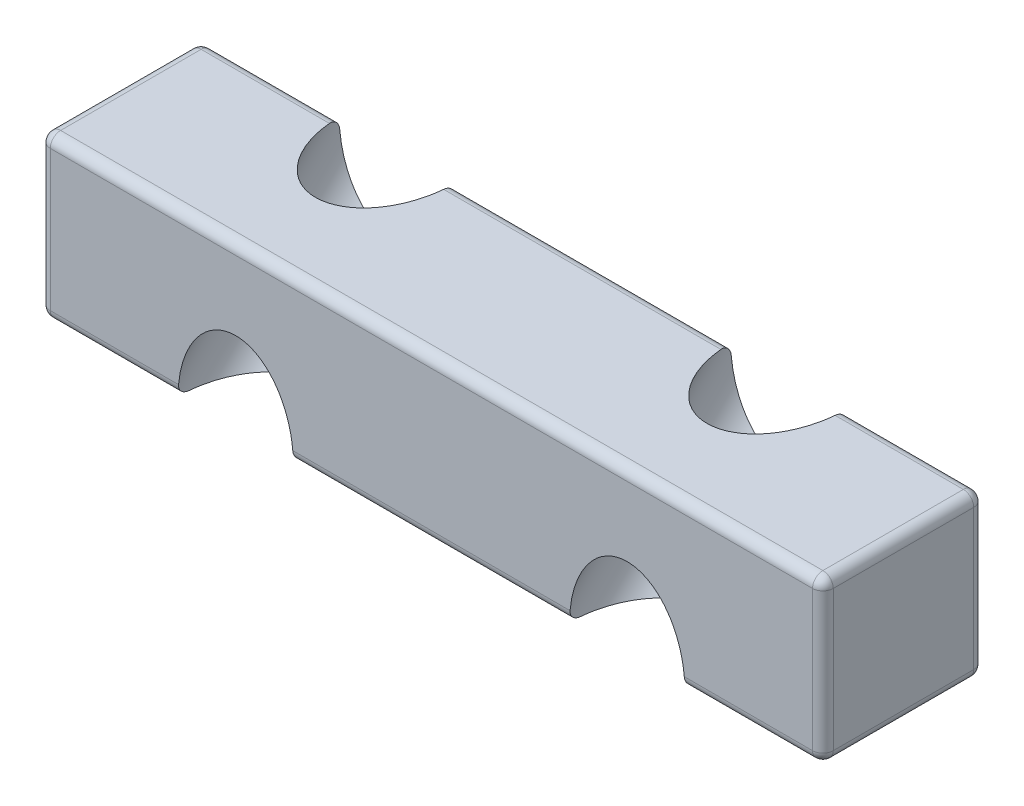
from build123d import *

# Parameters (mm, degrees)
SKETCH1_W               = 34
SKETCH1_H               = 7
BOSS_EXTRUDE1_DEPTH     = 7
CUT_EXTRUDE2_DEPTH      = 36.411862419
CUT_EXTRUDE2_DEPTH_BACK = 36.411862419
SKETCH6_OUTSIDE_W       = 43.082
SKETCH6_OUTSIDE_H       = 18.981
SKETCH6_OUTSIDE_W_2     = 34
SKETCH6_OUTSIDE_H_2     = 9.899494937
SKETCH6_OUTSIDE_R       = 2.5
FILLET1_R               = 0.45


with BuildPart() as part:
    # sketch1 → Boss-Extrude1 (new body)
    with BuildSketch(Plane(origin=(0, 0, 0), x_dir=(1, 0, 0), z_dir=(0, 1, 0))):
        with Locations((17, -3.5)):
            Rectangle(SKETCH1_W, SKETCH1_H)
    extrude(amount=BOSS_EXTRUDE1_DEPTH)

    # Sketch6 outside → Cut-Extrude2 (cut, two sides: drawn at the far end of the back side and taken through both)
    # profile 1 of 3: a face of its own
    with BuildSketch(Plane(origin=(0, 0, 0), x_dir=(-1, 0, 0), z_dir=(0, 0.7071067811865475, -0.7071067811865477)).offset(-CUT_EXTRUDE2_DEPTH_BACK)):
        with Locations((-17, 4.9495)):
            Rectangle(SKETCH6_OUTSIDE_W, SKETCH6_OUTSIDE_H)
        with Locations((-17, 4.949747469)):
            Rectangle(SKETCH6_OUTSIDE_W_2, SKETCH6_OUTSIDE_H_2, mode=Mode.SUBTRACT)
    # profile 2 of 3: a face of its own
    with BuildSketch(Plane(origin=(0, 0, 0), x_dir=(-1, 0, 0), z_dir=(0, 0.7071067811865475, -0.7071067811865477)).offset(-CUT_EXTRUDE2_DEPTH_BACK)):
        with Locations((-25.5, 4.949747468)):
            Circle(SKETCH6_OUTSIDE_R)
    # profile 3 of 3: a face of its own
    with BuildSketch(Plane(origin=(0, 0, 0), x_dir=(-1, 0, 0), z_dir=(0, 0.7071067811865475, -0.7071067811865477)).offset(-CUT_EXTRUDE2_DEPTH_BACK)):
        with Locations(Location((-8.5, 4.949747468, 0), (0, 0, 180))):
            Circle(SKETCH6_OUTSIDE_R)
    extrude(amount=CUT_EXTRUDE2_DEPTH + CUT_EXTRUDE2_DEPTH_BACK, mode=Mode.SUBTRACT)

    # Fillet1
    # the kernel refuses this fillet: 0.45 mm, written as the material it takes off along each edge
    with BuildSketch(Plane(origin=(33.55, 6.55, 0.45), x_dir=(1, 0, 0), z_dir=(0, 0, -1))) as fillet1_piece_1_section:
        Polygon((0, 0), (FILLET1_R, 0), (FILLET1_R, -FILLET1_R), (0, -FILLET1_R), align=None)
    fillet1_piece_1 = extrude(amount=FILLET1_R, mode=Mode.PRIVATE)
    fillet1_piece_1 = fillet1_piece_1 - Plane(origin=(33.55, 6.55, 0.45), x_dir=(-0.7071067811865475, -0.7071067811865475, 0), z_dir=(0, 0, -1)) * Sphere(FILLET1_R, mode=Mode.PRIVATE)
    add(fillet1_piece_1, mode=Mode.SUBTRACT)
    with BuildSketch(Plane(origin=(0.45, 6.55, 0.45), x_dir=(0, 1, 0), z_dir=(0, 0, -1))) as fillet1_piece_2_section:
        Polygon((0, 0), (FILLET1_R, 0), (FILLET1_R, -FILLET1_R), (0, -FILLET1_R), align=None)
    fillet1_piece_2 = extrude(amount=FILLET1_R, mode=Mode.PRIVATE)
    fillet1_piece_2 = fillet1_piece_2 - Plane(origin=(0.45, 6.55, 0.45), x_dir=(0.7071067811865475, -0.7071067811865475, 0), z_dir=(0, 0, -1)) * Sphere(FILLET1_R, mode=Mode.PRIVATE)
    add(fillet1_piece_2, mode=Mode.SUBTRACT)
    with BuildSketch(Plane(origin=(33.55, 0.45, 0.45), x_dir=(0, -1, 0), z_dir=(0, 0, -1))) as fillet1_piece_3_section:
        Polygon((0, 0), (FILLET1_R, 0), (FILLET1_R, -FILLET1_R), (0, -FILLET1_R), align=None)
    fillet1_piece_3 = extrude(amount=FILLET1_R, mode=Mode.PRIVATE)
    fillet1_piece_3 = fillet1_piece_3 - Plane(origin=(33.55, 0.45, 0.45), x_dir=(-0.7071067811865475, 0.7071067811865475, 0), z_dir=(0, 0, -1)) * Sphere(FILLET1_R, mode=Mode.PRIVATE)
    add(fillet1_piece_3, mode=Mode.SUBTRACT)
    with BuildSketch(Plane(origin=(33.55, 0.45, 6.55), x_dir=(1, 0, 0), z_dir=(0, -1, 0))) as fillet1_piece_4_section:
        Polygon((0, 0), (FILLET1_R, 0), (FILLET1_R, FILLET1_R), (0, FILLET1_R), align=None)
    fillet1_piece_4 = extrude(amount=FILLET1_R, mode=Mode.PRIVATE)
    fillet1_piece_4 = fillet1_piece_4 - Plane(origin=(33.55, 0.45, 6.55), x_dir=(-0.7071067811865475, 0, -0.7071067811865475), z_dir=(0, -1, 0)) * Sphere(FILLET1_R, mode=Mode.PRIVATE)
    add(fillet1_piece_4, mode=Mode.SUBTRACT)
    with BuildSketch(Plane(origin=(33.55, 6.55, 6.55), x_dir=(0, 1, 0), z_dir=(1, 0, 0))) as fillet1_piece_5_section:
        Polygon((0, 0), (FILLET1_R, 0), (FILLET1_R, FILLET1_R), (0, FILLET1_R), align=None)
    fillet1_piece_5 = extrude(amount=FILLET1_R, mode=Mode.PRIVATE)
    fillet1_piece_5 = fillet1_piece_5 - Plane(origin=(33.55, 6.55, 6.55), x_dir=(0, -0.7071067811865475, -0.7071067811865475), z_dir=(1, 0, 0)) * Sphere(FILLET1_R, mode=Mode.PRIVATE)
    add(fillet1_piece_5, mode=Mode.SUBTRACT)
    with BuildSketch(Plane(origin=(0.45, 0.45, 6.55), x_dir=(-1, 0, 0), z_dir=(0, -1, 0))) as fillet1_piece_6_section:
        Polygon((0, 0), (FILLET1_R, 0), (FILLET1_R, -FILLET1_R), (0, -FILLET1_R), align=None)
    fillet1_piece_6 = extrude(amount=FILLET1_R, mode=Mode.PRIVATE)
    fillet1_piece_6 = fillet1_piece_6 - Plane(origin=(0.45, 0.45, 6.55), x_dir=(0.7071067811865475, 0, -0.7071067811865477), z_dir=(0, -1, 0)) * Sphere(FILLET1_R, mode=Mode.PRIVATE)
    add(fillet1_piece_6, mode=Mode.SUBTRACT)
    with BuildSketch(Plane(origin=(0.45, 0.45, 0.45), x_dir=(0, -1, 0), z_dir=(0, 0, -1))) as fillet1_piece_7_section:
        Polygon((0, 0), (FILLET1_R, 0), (FILLET1_R, FILLET1_R), (0, FILLET1_R), align=None)
    fillet1_piece_7 = extrude(amount=FILLET1_R, mode=Mode.PRIVATE)
    fillet1_piece_7 = fillet1_piece_7 - Plane(origin=(0.45, 0.45, 0.45), x_dir=(0.7071067811865475, 0.7071067811865475, 0), z_dir=(0, 0, -1)) * Sphere(FILLET1_R, mode=Mode.PRIVATE)
    add(fillet1_piece_7, mode=Mode.SUBTRACT)
    with BuildSketch(Plane(origin=(0.45, 6.55, 6.55), x_dir=(-1, 0, 0), z_dir=(0, 1, 0))) as fillet1_piece_8_section:
        Polygon((0, 0), (FILLET1_R, 0), (FILLET1_R, FILLET1_R), (0, FILLET1_R), align=None)
    fillet1_piece_8 = extrude(amount=FILLET1_R, mode=Mode.PRIVATE)
    fillet1_piece_8 = fillet1_piece_8 - Plane(origin=(0.45, 6.55, 6.55), x_dir=(0.7071067811865475, 0, -0.7071067811865477), z_dir=(0, 1, 0)) * Sphere(FILLET1_R, mode=Mode.PRIVATE)
    add(fillet1_piece_8, mode=Mode.SUBTRACT)
    with BuildSketch(Plane(origin=(26.875, 7, 0), x_dir=(0, -1, 0), z_dir=(1, 0, 0)), Plane(origin=(0.45, 7, 0), x_dir=(0, -1, 0), z_dir=(1, 0, 0)), Plane(origin=(33.55, 0, 7), x_dir=(0, 0, -1), z_dir=(-1, 0, 0)), Plane(origin=(7.125, 0, 7), x_dir=(0, 0, -1), z_dir=(-1, 0, 0))) as fillet1_piece_9:
        with BuildLine():
            CenterArc((FILLET1_R, -FILLET1_R), FILLET1_R, 90, 90)
            Line((0, -FILLET1_R), (0, 0))
            Line((0, 0), (FILLET1_R, 0))
        make_face()
    extrude(amount=6.675, mode=Mode.SUBTRACT)
    with BuildSketch(Plane(origin=(9.875, 7, 0), x_dir=(0, -1, 0), z_dir=(1, 0, 0)), Plane(origin=(24.125, 0, 7), x_dir=(0, 0, -1), z_dir=(-1, 0, 0))) as fillet1_piece_10:
        with BuildLine():
            CenterArc((FILLET1_R, -FILLET1_R), FILLET1_R, 90, 90)
            Line((0, -FILLET1_R), (0, 0))
            Line((0, 0), (FILLET1_R, 0))
        make_face()
    extrude(amount=14.25, mode=Mode.SUBTRACT)
    with BuildSketch(Plane(origin=(34, 0, 0.45), x_dir=(-1, 0, 0), z_dir=(0, 0, 1)), Plane(origin=(34, 7, 0.45), x_dir=(0, -1, 0), z_dir=(0, 0, 1)), Plane(origin=(0, 0.45, 0), x_dir=(1, 0, 0), z_dir=(0, 1, 0)), Plane(origin=(0, 0.45, 7), x_dir=(0, 0, -1), z_dir=(0, 1, 0)), Plane(origin=(0, 0, 6.55), x_dir=(1, 0, 0), z_dir=(0, 0, -1))) as fillet1_piece_11:
        with BuildLine():
            CenterArc((FILLET1_R, -FILLET1_R), FILLET1_R, 90, 90)
            Line((0, -FILLET1_R), (0, 0))
            Line((0, 0), (FILLET1_R, 0))
        make_face()
    extrude(amount=6.1, mode=Mode.SUBTRACT)
    with BuildSketch(Plane(origin=(34, 0.45, 0), x_dir=(-1, 0, 0), z_dir=(0, 1, 0)), Plane(origin=(34, 0.45, 7), x_dir=(0, 0, -1), z_dir=(0, 1, 0)), Plane(origin=(0, 7, 6.55), x_dir=(1, 0, 0), z_dir=(0, 0, -1))) as fillet1_piece_12:
        with BuildLine():
            CenterArc((FILLET1_R, FILLET1_R), FILLET1_R, 180, 90)
            Line((0, FILLET1_R), (0, 0))
            Line((0, 0), (FILLET1_R, 0))
        make_face()
    extrude(amount=6.1, mode=Mode.SUBTRACT)
    with BuildSketch(Plane(origin=(0.45, 0, 0), x_dir=(0, 1, 0), z_dir=(1, 0, 0)), Plane(origin=(33.55, 7, 7), x_dir=(0, 0, -1), z_dir=(-1, 0, 0))) as fillet1_piece_13:
        with BuildLine():
            CenterArc((FILLET1_R, FILLET1_R), FILLET1_R, 180, 90)
            Line((0, FILLET1_R), (0, 0))
            Line((0, 0), (FILLET1_R, 0))
        make_face()
    extrude(amount=33.1, mode=Mode.SUBTRACT)


solid = part.part
